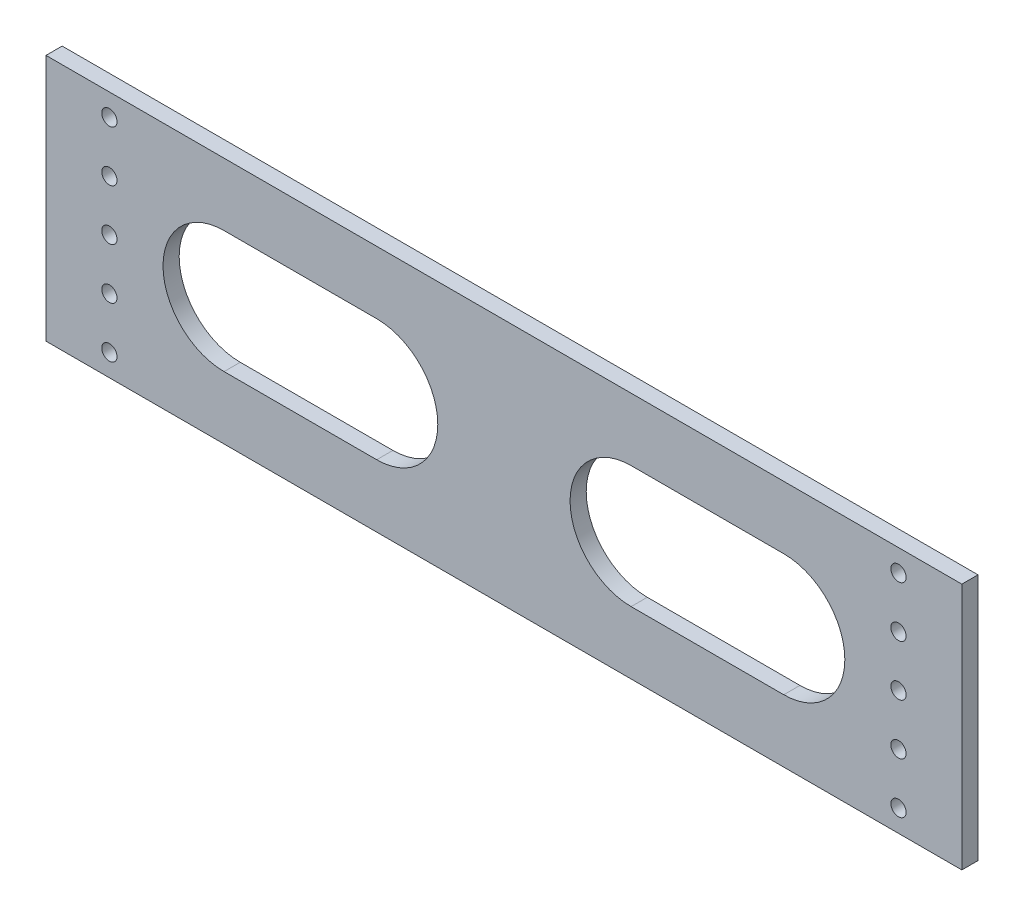
from build123d import *

# Parameters (mm, degrees)
SKETCH1_W                = 186.35
SKETCH1_H                = 55
BOSS_EXTRUDE1_DEPTH      = 3.175
SKETCH2_W                = 6.35
SKETCH2_H                = 3.175
CUT_EXTRUDE1_DEPTH       = 10
LPATTERN1_COUNT          = 5
LPATTERN1_PITCH          = 6.35
LPATTERN1_COUNT_DIR2     = 5
LPATTERN1_PITCH_DIR2     = 6.35
MIRROR1_COPY_1_SKETCH_W  = 6.35
MIRROR1_COPY_1_SKETCH_H  = 3.175
MIRROR1_COPY_1_DEPTH     = 10
MIRROR1_COPY_2_SKETCH_W  = 6.35
MIRROR1_COPY_2_SKETCH_H  = 3.175
MIRROR1_COPY_2_DEPTH     = 10
MIRROR1_COPY_3_SKETCH_W  = 6.35
MIRROR1_COPY_3_SKETCH_H  = 3.175
MIRROR1_COPY_3_DEPTH     = 10
MIRROR1_COPY_4_SKETCH_W  = 6.35
MIRROR1_COPY_4_SKETCH_H  = 3.175
MIRROR1_COPY_4_DEPTH     = 10
MIRROR1_COPY_5_SKETCH_W  = 6.35
MIRROR1_COPY_5_SKETCH_H  = 3.175
MIRROR1_COPY_5_DEPTH     = 10
MIRROR1_COPY_6_SKETCH_W  = 6.35
MIRROR1_COPY_6_SKETCH_H  = 3.175
MIRROR1_COPY_6_DEPTH     = 10
MIRROR1_COPY_7_SKETCH_W  = 6.35
MIRROR1_COPY_7_SKETCH_H  = 3.175
MIRROR1_COPY_7_DEPTH     = 10
MIRROR1_COPY_8_SKETCH_W  = 6.35
MIRROR1_COPY_8_SKETCH_H  = 3.175
MIRROR1_COPY_8_DEPTH     = 10
MIRROR1_COPY_9_SKETCH_W  = 6.35
MIRROR1_COPY_9_SKETCH_H  = 3.175
MIRROR1_COPY_9_DEPTH     = 10
MIRROR1_COPY_10_SKETCH_W = 6.35
MIRROR1_COPY_10_SKETCH_H = 3.175
MIRROR1_COPY_10_DEPTH    = 10
MIRROR1_COPY_11_SKETCH_W = 6.35
MIRROR1_COPY_11_SKETCH_H = 3.175
MIRROR1_COPY_11_DEPTH    = 10
MIRROR1_COPY_12_SKETCH_W = 6.35
MIRROR1_COPY_12_SKETCH_H = 3.175
MIRROR1_COPY_12_DEPTH    = 10
MIRROR1_COPY_13_SKETCH_W = 6.35
MIRROR1_COPY_13_SKETCH_H = 3.175
MIRROR1_COPY_13_DEPTH    = 10
MIRROR1_COPY_14_SKETCH_W = 6.35
MIRROR1_COPY_14_SKETCH_H = 3.175
MIRROR1_COPY_14_DEPTH    = 10
MIRROR1_COPY_15_SKETCH_W = 6.35
MIRROR1_COPY_15_SKETCH_H = 3.175
MIRROR1_COPY_15_DEPTH    = 10
MIRROR1_COPY_16_SKETCH_W = 6.35
MIRROR1_COPY_16_SKETCH_H = 3.175
MIRROR1_COPY_16_DEPTH    = 10
MIRROR1_COPY_17_SKETCH_W = 6.35
MIRROR1_COPY_17_SKETCH_H = 3.175
MIRROR1_COPY_17_DEPTH    = 10
MIRROR1_COPY_18_SKETCH_W = 6.35
MIRROR1_COPY_18_SKETCH_H = 3.175
MIRROR1_COPY_18_DEPTH    = 10
MIRROR1_COPY_19_SKETCH_W = 6.35
MIRROR1_COPY_19_SKETCH_H = 3.175
MIRROR1_COPY_19_DEPTH    = 10
MIRROR1_COPY_20_SKETCH_W = 6.35
MIRROR1_COPY_20_SKETCH_H = 3.175
MIRROR1_COPY_20_DEPTH    = 10
MIRROR1_COPY_21_SKETCH_W = 6.35
MIRROR1_COPY_21_SKETCH_H = 3.175
MIRROR1_COPY_21_DEPTH    = 10
MIRROR1_COPY_22_SKETCH_W = 6.35
MIRROR1_COPY_22_SKETCH_H = 3.175
MIRROR1_COPY_22_DEPTH    = 10
MIRROR1_COPY_23_SKETCH_W = 6.35
MIRROR1_COPY_23_SKETCH_H = 3.175
MIRROR1_COPY_23_DEPTH    = 10
SKETCH3_W                = 3.175
SKETCH3_H                = 3.6875
CUT_EXTRUDE2_DEPTH       = 10
SKETCH4_W                = 3.175
SKETCH4_H                = 6.35
CUT_EXTRUDE3_DEPTH       = 10
LPATTERN2_COUNT          = 15
LPATTERN2_PITCH          = 6.35
LPATTERN2_COUNT_DIR2     = 15
LPATTERN2_PITCH_DIR2     = 6.35
SKETCH5_W                = 5.375
SKETCH5_H                = 6.35
CUT_EXTRUDE4_DEPTH       = 10
CUT_EXTRUDE5_DEPTH       = 10
SKETCH7_R                = 1.5
CUT_EXTRUDE6_DEPTH       = 10
LPATTERN3_COUNT          = 3
LPATTERN3_PITCH          = 10
LPATTERN3_COL_COUNT      = 3
LPATTERN3_COL_PITCH      = 10
MIRROR3_COPY_1_SKETCH_R  = 1.5
MIRROR3_COPY_1_DEPTH     = 10
MIRROR3_COPY_2_SKETCH_R  = 1.5
MIRROR3_COPY_2_DEPTH     = 10
MIRROR3_COPY_3_SKETCH_R  = 1.5
MIRROR3_COPY_3_DEPTH     = 10
MIRROR3_COPY_4_SKETCH_R  = 1.5
MIRROR3_COPY_4_DEPTH     = 10
SKETCH8_W                = 180
SKETCH8_H                = 3.175
CUT_EXTRUDE7_DEPTH       = 10
SKETCH9_W                = 3.175
SKETCH9_H                = 48.65
CUT_EXTRUDE8_DEPTH       = 10


# Read off the part's stored shape, not the designer's step: Mirror2
with BuildPart() as part:
    # Sketch1 → Boss-Extrude1 (new body)
    with BuildSketch(Plane.XY):
        Rectangle(SKETCH1_W, SKETCH1_H)
    extrude(amount=BOSS_EXTRUDE1_DEPTH)

    # Sketch2 → Cut-Extrude1 (cut)
    with BuildSketch(Plane.XY.offset(3.175)):
        with Locations((93.175, -3.175)):
            Rectangle(SKETCH2_W, SKETCH2_H)
    cut_extrude1 = extrude(amount=-CUT_EXTRUDE1_DEPTH, mode=Mode.SUBTRACT)

    # LPattern1: Cut-Extrude1 5 × 5, 1 skipped
    with Locations(*[Vector(0, 1, 0) * (i * LPATTERN1_PITCH) + Vector(0, -1, 0) * (j * LPATTERN1_PITCH_DIR2) for i in range(LPATTERN1_COUNT) for j in range(LPATTERN1_COUNT_DIR2) if (i, j) not in ((0, 0), (0, 4))]):
        add(cut_extrude1, mode=Mode.SUBTRACT)

    # Mirror1: Cut-Extrude1 across plane
    add(cut_extrude1.mirror(Plane(origin=(0, 0, 0), x_dir=(0, 0, 1), z_dir=(1, 0, 0))), mode=Mode.SUBTRACT)

    # Mirror1 copy 1 sketch → Mirror1 copy 1 (cut)
    with BuildSketch(Plane(origin=(0, -6.35, 3.175), x_dir=(-1, 0, 0), z_dir=(0, 0, 1))):
        with Locations((93.175, 3.175)):
            Rectangle(MIRROR1_COPY_1_SKETCH_W, MIRROR1_COPY_1_SKETCH_H)
    extrude(amount=-MIRROR1_COPY_1_DEPTH, mode=Mode.SUBTRACT)

    # Mirror1 copy 2 sketch → Mirror1 copy 2 (cut)
    with BuildSketch(Plane(origin=(0, -12.7, 3.175), x_dir=(-1, 0, 0), z_dir=(0, 0, 1))):
        with Locations((93.175, 3.175)):
            Rectangle(MIRROR1_COPY_2_SKETCH_W, MIRROR1_COPY_2_SKETCH_H)
    extrude(amount=-MIRROR1_COPY_2_DEPTH, mode=Mode.SUBTRACT)

    # Mirror1 copy 3 sketch → Mirror1 copy 3 (cut)
    with BuildSketch(Plane(origin=(0, -19.05, 3.175), x_dir=(-1, 0, 0), z_dir=(0, 0, 1))):
        with Locations((93.175, 3.175)):
            Rectangle(MIRROR1_COPY_3_SKETCH_W, MIRROR1_COPY_3_SKETCH_H)
    extrude(amount=-MIRROR1_COPY_3_DEPTH, mode=Mode.SUBTRACT)

    # Mirror1 copy 4 sketch → Mirror1 copy 4 (cut)
    with BuildSketch(Plane(origin=(0, 6.35, 3.175), x_dir=(-1, 0, 0), z_dir=(0, 0, 1))):
        with Locations((93.175, 3.175)):
            Rectangle(MIRROR1_COPY_4_SKETCH_W, MIRROR1_COPY_4_SKETCH_H)
    extrude(amount=-MIRROR1_COPY_4_DEPTH, mode=Mode.SUBTRACT)

    # Mirror1 copy 5 sketch → Mirror1 copy 5 (cut)
    with BuildSketch(Plane(origin=(0, 0, 3.175), x_dir=(-1, 0, 0), z_dir=(0, 0, 1))):
        with Locations((93.175, 3.175)):
            Rectangle(MIRROR1_COPY_5_SKETCH_W, MIRROR1_COPY_5_SKETCH_H)
    extrude(amount=-MIRROR1_COPY_5_DEPTH, mode=Mode.SUBTRACT)

    # Mirror1 copy 6 sketch → Mirror1 copy 6 (cut)
    with BuildSketch(Plane(origin=(0, -6.35, 3.175), x_dir=(-1, 0, 0), z_dir=(0, 0, 1))):
        with Locations((93.175, 3.175)):
            Rectangle(MIRROR1_COPY_6_SKETCH_W, MIRROR1_COPY_6_SKETCH_H)
    extrude(amount=-MIRROR1_COPY_6_DEPTH, mode=Mode.SUBTRACT)

    # Mirror1 copy 7 sketch → Mirror1 copy 7 (cut)
    with BuildSketch(Plane(origin=(0, -12.7, 3.175), x_dir=(-1, 0, 0), z_dir=(0, 0, 1))):
        with Locations((93.175, 3.175)):
            Rectangle(MIRROR1_COPY_7_SKETCH_W, MIRROR1_COPY_7_SKETCH_H)
    extrude(amount=-MIRROR1_COPY_7_DEPTH, mode=Mode.SUBTRACT)

    # Mirror1 copy 8 sketch → Mirror1 copy 8 (cut)
    with BuildSketch(Plane(origin=(0, -19.05, 3.175), x_dir=(-1, 0, 0), z_dir=(0, 0, 1))):
        with Locations((93.175, 3.175)):
            Rectangle(MIRROR1_COPY_8_SKETCH_W, MIRROR1_COPY_8_SKETCH_H)
    extrude(amount=-MIRROR1_COPY_8_DEPTH, mode=Mode.SUBTRACT)

    # Mirror1 copy 9 sketch → Mirror1 copy 9 (cut)
    with BuildSketch(Plane(origin=(0, 12.7, 3.175), x_dir=(-1, 0, 0), z_dir=(0, 0, 1))):
        with Locations((93.175, 3.175)):
            Rectangle(MIRROR1_COPY_9_SKETCH_W, MIRROR1_COPY_9_SKETCH_H)
    extrude(amount=-MIRROR1_COPY_9_DEPTH, mode=Mode.SUBTRACT)

    # Mirror1 copy 10 sketch → Mirror1 copy 10 (cut)
    with BuildSketch(Plane(origin=(0, 6.35, 3.175), x_dir=(-1, 0, 0), z_dir=(0, 0, 1))):
        with Locations((93.175, 3.175)):
            Rectangle(MIRROR1_COPY_10_SKETCH_W, MIRROR1_COPY_10_SKETCH_H)
    extrude(amount=-MIRROR1_COPY_10_DEPTH, mode=Mode.SUBTRACT)

    # Mirror1 copy 11 sketch → Mirror1 copy 11 (cut)
    with BuildSketch(Plane(origin=(0, 0, 3.175), x_dir=(-1, 0, 0), z_dir=(0, 0, 1))):
        with Locations((93.175, 3.175)):
            Rectangle(MIRROR1_COPY_11_SKETCH_W, MIRROR1_COPY_11_SKETCH_H)
    extrude(amount=-MIRROR1_COPY_11_DEPTH, mode=Mode.SUBTRACT)

    # Mirror1 copy 12 sketch → Mirror1 copy 12 (cut)
    with BuildSketch(Plane(origin=(0, -6.35, 3.175), x_dir=(-1, 0, 0), z_dir=(0, 0, 1))):
        with Locations((93.175, 3.175)):
            Rectangle(MIRROR1_COPY_12_SKETCH_W, MIRROR1_COPY_12_SKETCH_H)
    extrude(amount=-MIRROR1_COPY_12_DEPTH, mode=Mode.SUBTRACT)

    # Mirror1 copy 13 sketch → Mirror1 copy 13 (cut)
    with BuildSketch(Plane(origin=(0, -12.7, 3.175), x_dir=(-1, 0, 0), z_dir=(0, 0, 1))):
        with Locations((93.175, 3.175)):
            Rectangle(MIRROR1_COPY_13_SKETCH_W, MIRROR1_COPY_13_SKETCH_H)
    extrude(amount=-MIRROR1_COPY_13_DEPTH, mode=Mode.SUBTRACT)

    # Mirror1 copy 14 sketch → Mirror1 copy 14 (cut)
    with BuildSketch(Plane(origin=(0, 19.05, 3.175), x_dir=(-1, 0, 0), z_dir=(0, 0, 1))):
        with Locations((93.175, 3.175)):
            Rectangle(MIRROR1_COPY_14_SKETCH_W, MIRROR1_COPY_14_SKETCH_H)
    extrude(amount=-MIRROR1_COPY_14_DEPTH, mode=Mode.SUBTRACT)

    # Mirror1 copy 15 sketch → Mirror1 copy 15 (cut)
    with BuildSketch(Plane(origin=(0, 12.7, 3.175), x_dir=(-1, 0, 0), z_dir=(0, 0, 1))):
        with Locations((93.175, 3.175)):
            Rectangle(MIRROR1_COPY_15_SKETCH_W, MIRROR1_COPY_15_SKETCH_H)
    extrude(amount=-MIRROR1_COPY_15_DEPTH, mode=Mode.SUBTRACT)

    # Mirror1 copy 16 sketch → Mirror1 copy 16 (cut)
    with BuildSketch(Plane(origin=(0, 6.35, 3.175), x_dir=(-1, 0, 0), z_dir=(0, 0, 1))):
        with Locations((93.175, 3.175)):
            Rectangle(MIRROR1_COPY_16_SKETCH_W, MIRROR1_COPY_16_SKETCH_H)
    extrude(amount=-MIRROR1_COPY_16_DEPTH, mode=Mode.SUBTRACT)

    # Mirror1 copy 17 sketch → Mirror1 copy 17 (cut)
    with BuildSketch(Plane(origin=(0, 0, 3.175), x_dir=(-1, 0, 0), z_dir=(0, 0, 1))):
        with Locations((93.175, 3.175)):
            Rectangle(MIRROR1_COPY_17_SKETCH_W, MIRROR1_COPY_17_SKETCH_H)
    extrude(amount=-MIRROR1_COPY_17_DEPTH, mode=Mode.SUBTRACT)

    # Mirror1 copy 18 sketch → Mirror1 copy 18 (cut)
    with BuildSketch(Plane(origin=(0, -6.35, 3.175), x_dir=(-1, 0, 0), z_dir=(0, 0, 1))):
        with Locations((93.175, 3.175)):
            Rectangle(MIRROR1_COPY_18_SKETCH_W, MIRROR1_COPY_18_SKETCH_H)
    extrude(amount=-MIRROR1_COPY_18_DEPTH, mode=Mode.SUBTRACT)

    # Mirror1 copy 19 sketch → Mirror1 copy 19 (cut)
    with BuildSketch(Plane(origin=(0, 25.4, 3.175), x_dir=(-1, 0, 0), z_dir=(0, 0, 1))):
        with Locations((93.175, 3.175)):
            Rectangle(MIRROR1_COPY_19_SKETCH_W, MIRROR1_COPY_19_SKETCH_H)
    extrude(amount=-MIRROR1_COPY_19_DEPTH, mode=Mode.SUBTRACT)

    # Mirror1 copy 20 sketch → Mirror1 copy 20 (cut)
    with BuildSketch(Plane(origin=(0, 19.05, 3.175), x_dir=(-1, 0, 0), z_dir=(0, 0, 1))):
        with Locations((93.175, 3.175)):
            Rectangle(MIRROR1_COPY_20_SKETCH_W, MIRROR1_COPY_20_SKETCH_H)
    extrude(amount=-MIRROR1_COPY_20_DEPTH, mode=Mode.SUBTRACT)

    # Mirror1 copy 21 sketch → Mirror1 copy 21 (cut)
    with BuildSketch(Plane(origin=(0, 12.7, 3.175), x_dir=(-1, 0, 0), z_dir=(0, 0, 1))):
        with Locations((93.175, 3.175)):
            Rectangle(MIRROR1_COPY_21_SKETCH_W, MIRROR1_COPY_21_SKETCH_H)
    extrude(amount=-MIRROR1_COPY_21_DEPTH, mode=Mode.SUBTRACT)

    # Mirror1 copy 22 sketch → Mirror1 copy 22 (cut)
    with BuildSketch(Plane(origin=(0, 6.35, 3.175), x_dir=(-1, 0, 0), z_dir=(0, 0, 1))):
        with Locations((93.175, 3.175)):
            Rectangle(MIRROR1_COPY_22_SKETCH_W, MIRROR1_COPY_22_SKETCH_H)
    extrude(amount=-MIRROR1_COPY_22_DEPTH, mode=Mode.SUBTRACT)

    # Mirror1 copy 23 sketch → Mirror1 copy 23 (cut)
    with BuildSketch(Plane(origin=(0, 0, 3.175), x_dir=(-1, 0, 0), z_dir=(0, 0, 1))):
        with Locations((93.175, 3.175)):
            Rectangle(MIRROR1_COPY_23_SKETCH_W, MIRROR1_COPY_23_SKETCH_H)
    extrude(amount=-MIRROR1_COPY_23_DEPTH, mode=Mode.SUBTRACT)

    # Sketch3 → Cut-Extrude2 (cut)
    with BuildSketch(Plane.XY.offset(3.175)):
        with Locations((-91.5875, 25.65625)):
            Rectangle(SKETCH3_W, SKETCH3_H)
        with Locations((91.5875, 25.65625)):
            Rectangle(SKETCH3_W, SKETCH3_H)
        with Locations((91.5875, -25.65625)):
            Rectangle(SKETCH3_W, SKETCH3_H)
        with Locations((-91.5875, -25.65625)):
            Rectangle(SKETCH3_W, SKETCH3_H)
    extrude(amount=-CUT_EXTRUDE2_DEPTH, mode=Mode.SUBTRACT)

    # Sketch4 → Cut-Extrude3 (cut)
    with BuildSketch(Plane.XY.offset(3.175)):
        with Locations((3.175, 27.5)):
            Rectangle(SKETCH4_W, SKETCH4_H)
    cut_extrude3 = extrude(amount=-CUT_EXTRUDE3_DEPTH, mode=Mode.SUBTRACT)

    # LPattern2: Cut-Extrude3 15 × 15, 1 skipped
    with Locations(*[Vector(1, 0, 0) * (i * LPATTERN2_PITCH) + Vector(-1, 0, 0) * (j * LPATTERN2_PITCH_DIR2) for i in range(LPATTERN2_COUNT) for j in range(LPATTERN2_COUNT_DIR2) if (i, j) not in ((0, 0), (14, 0))]):
        add(cut_extrude3, mode=Mode.SUBTRACT)

    # Mirror2
    split(bisect_by=Plane.ZX, keep=Keep.TOP)

    # Mirror2 2: part across plane


with BuildPart() as part_1:
    add(part.part)
    add(part.part.mirror(Plane.ZX))

    # Sketch5 → Cut-Extrude4 (cut)
    with BuildSketch(Plane.XY.offset(3.175)):
        with Locations((-90, 27.5)):
            Rectangle(SKETCH5_W, SKETCH5_H)
        with Locations((90, 27.5)):
            Rectangle(SKETCH5_W, SKETCH5_H)
        with Locations((90, -27.5)):
            Rectangle(SKETCH5_W, SKETCH5_H)
        with Locations((-90, -27.5)):
            Rectangle(SKETCH5_W, SKETCH5_H)
    extrude(amount=-CUT_EXTRUDE4_DEPTH, mode=Mode.SUBTRACT)

    # Sketch6 → Cut-Extrude5 (cut)
    with BuildSketch(Plane.XY.offset(3.175)):
        with BuildLine():
            Line((-25, -12), (-55, -12))
            ThreePointArc((-55, -12), (-67, 0), (-55, 12))
            Line((-55, 12), (-25, 12))
            ThreePointArc((-25, 12), (-13, 0), (-25, -12))
        make_face()
        with BuildLine():
            Line((55, -12), (25, -12))
            ThreePointArc((25, -12), (13, 0), (25, 12))
            Line((25, 12), (55, 12))
            ThreePointArc((55, 12), (67, 0), (55, -12))
        make_face()
    extrude(amount=-CUT_EXTRUDE5_DEPTH, mode=Mode.SUBTRACT)

    # Sketch7 → Cut-Extrude6 (cut)
    with BuildSketch(Plane(origin=(0, 0, 0), x_dir=(-1, 0, 0), z_dir=(0, 0, -1))):
        with Locations((-77.545, 0)):
            Circle(SKETCH7_R)
    cut_extrude6 = extrude(amount=-CUT_EXTRUDE6_DEPTH, mode=Mode.SUBTRACT)

    # LPattern3: Cut-Extrude6 ×3
    with Locations(*[(0, i * LPATTERN3_PITCH, 0) for i in range(1, LPATTERN3_COUNT)]):
        add(cut_extrude6, mode=Mode.SUBTRACT)

    # LPattern3 col: Cut-Extrude6 ×3
    with Locations(*[(0, -i * LPATTERN3_COL_PITCH, 0) for i in range(1, LPATTERN3_COL_COUNT)]):
        add(cut_extrude6, mode=Mode.SUBTRACT)

    # Mirror3: Cut-Extrude6 across plane
    add(cut_extrude6.mirror(Plane(origin=(0, 0, 0), x_dir=(0, 0, 1), z_dir=(1, 0, 0))), mode=Mode.SUBTRACT)

    # Mirror3 copy 1 sketch → Mirror3 copy 1 (cut)
    with BuildSketch(Plane(origin=(0, 10, 0), x_dir=(1, 0, 0), z_dir=(0, 0, -1))):
        with Locations((-77.545, 0)):
            Circle(MIRROR3_COPY_1_SKETCH_R)
    extrude(amount=-MIRROR3_COPY_1_DEPTH, mode=Mode.SUBTRACT)

    # Mirror3 copy 2 sketch → Mirror3 copy 2 (cut)
    with BuildSketch(Plane(origin=(0, 20, 0), x_dir=(1, 0, 0), z_dir=(0, 0, -1))):
        with Locations((-77.545, 0)):
            Circle(MIRROR3_COPY_2_SKETCH_R)
    extrude(amount=-MIRROR3_COPY_2_DEPTH, mode=Mode.SUBTRACT)

    # Mirror3 copy 3 sketch → Mirror3 copy 3 (cut)
    with BuildSketch(Plane(origin=(0, -10, 0), x_dir=(1, 0, 0), z_dir=(0, 0, -1))):
        with Locations((-77.545, 0)):
            Circle(MIRROR3_COPY_3_SKETCH_R)
    extrude(amount=-MIRROR3_COPY_3_DEPTH, mode=Mode.SUBTRACT)

    # Mirror3 copy 4 sketch → Mirror3 copy 4 (cut)
    with BuildSketch(Plane(origin=(0, -20, 0), x_dir=(1, 0, 0), z_dir=(0, 0, -1))):
        with Locations((-77.545, 0)):
            Circle(MIRROR3_COPY_4_SKETCH_R)
    extrude(amount=-MIRROR3_COPY_4_DEPTH, mode=Mode.SUBTRACT)

    # Sketch8 → Cut-Extrude7 (cut)
    with BuildSketch(Plane.XY.offset(3.175)):
        with Locations((0, 25.9125)):
            Rectangle(SKETCH8_W, SKETCH8_H)
    cut_extrude7 = extrude(amount=-CUT_EXTRUDE7_DEPTH, mode=Mode.SUBTRACT)

    # Mirror4: Cut-Extrude7 across plane
    add(cut_extrude7.mirror(Plane.ZX), mode=Mode.SUBTRACT)

    # Sketch9 → Cut-Extrude8 (cut)
    with BuildSketch(Plane.XY.offset(3.175)):
        with Locations((-91.5875, 0)):
            Rectangle(SKETCH9_W, SKETCH9_H)
    cut_extrude8 = extrude(amount=-CUT_EXTRUDE8_DEPTH, mode=Mode.SUBTRACT)

    # Mirror5: Cut-Extrude8 across plane
    add(cut_extrude8.mirror(Plane(origin=(0, 0, 0), x_dir=(0, 0, 1), z_dir=(1, 0, 0))), mode=Mode.SUBTRACT)


solid = part_1.part
